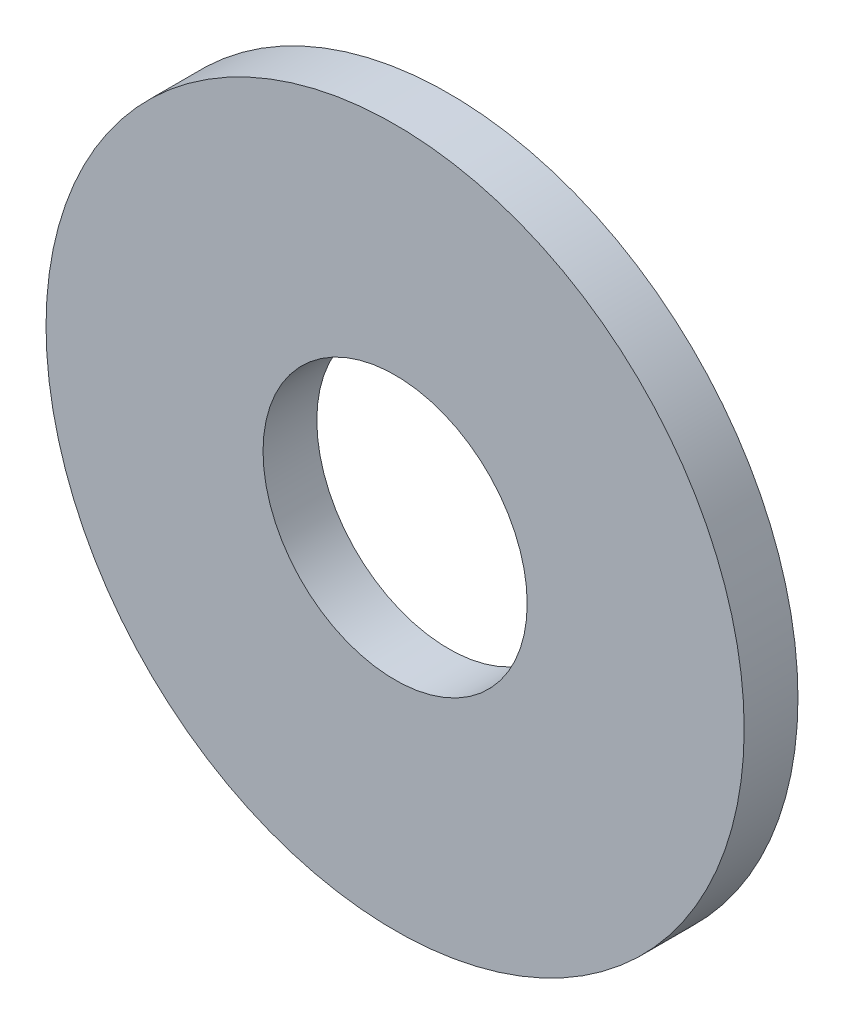
from build123d import *

# Parameters (mm, degrees)
SKETCH1_R      = 9.398
SKETCH1_R_2    = 3.556
EXTRUDE1_DEPTH = 1.4478


with BuildPart() as part:
    # Sketch1 → Extrude1 (new body)
    with BuildSketch(Plane.XY):
        Circle(SKETCH1_R)
        Circle(SKETCH1_R_2, mode=Mode.SUBTRACT)
    extrude(amount=-EXTRUDE1_DEPTH)


solid = part.part
